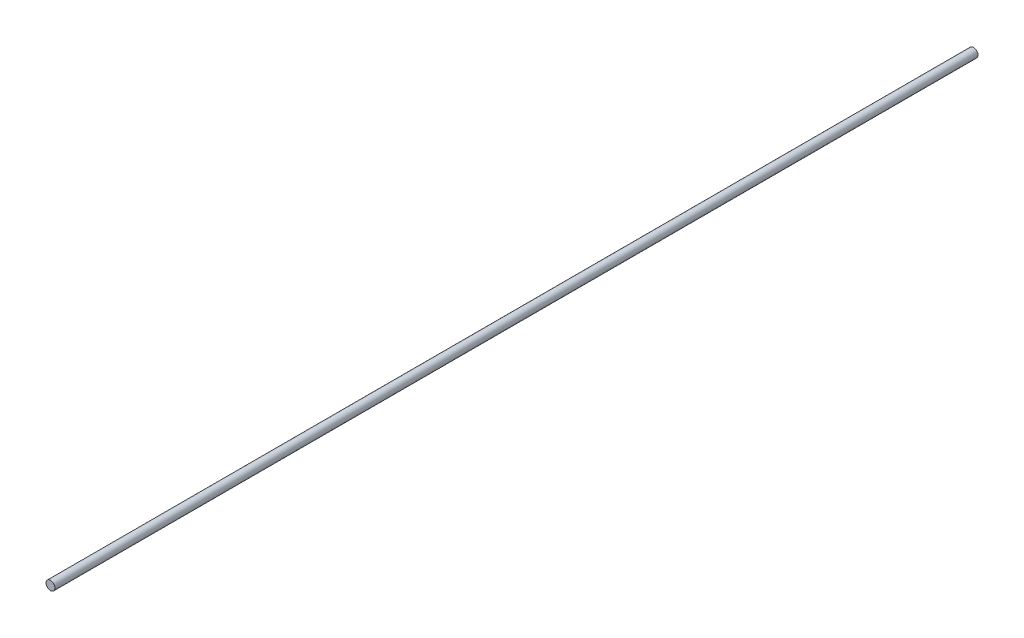
from build123d import *

# Parameters (mm, degrees)
SKETCH1_R           = 7.9375
BOSS_EXTRUDE1_DEPTH = 2254.25
SKETCH2_R           = 7.9375
CUT_EXTRUDE1_DEPTH  = 539.75
CUT_EXTRUDE2_START  = -69.85
SKETCH3_R           = 7.9375
CUT_EXTRUDE2_DEPTH  = 69.85


with BuildPart() as part:
    # Sketch1 → Boss-Extrude1 (new body)
    with BuildSketch(Plane.XY):
        Circle(SKETCH1_R)
    extrude(amount=BOSS_EXTRUDE1_DEPTH)

    # Sketch2 → Cut-Extrude1 (cut)
    with BuildSketch(Plane(origin=(0, 0, 0), x_dir=(-1, 0, 0), z_dir=(0, 0, -1))):
        Circle(SKETCH2_R)
    extrude(amount=-CUT_EXTRUDE1_DEPTH, mode=Mode.SUBTRACT)

    # Sketch3 → Cut-Extrude2 (cut)
    with BuildSketch(Plane.XY.offset(2254.25).offset(CUT_EXTRUDE2_START)):
        Circle(SKETCH3_R)
    extrude(amount=CUT_EXTRUDE2_DEPTH, mode=Mode.SUBTRACT)


solid = part.part
